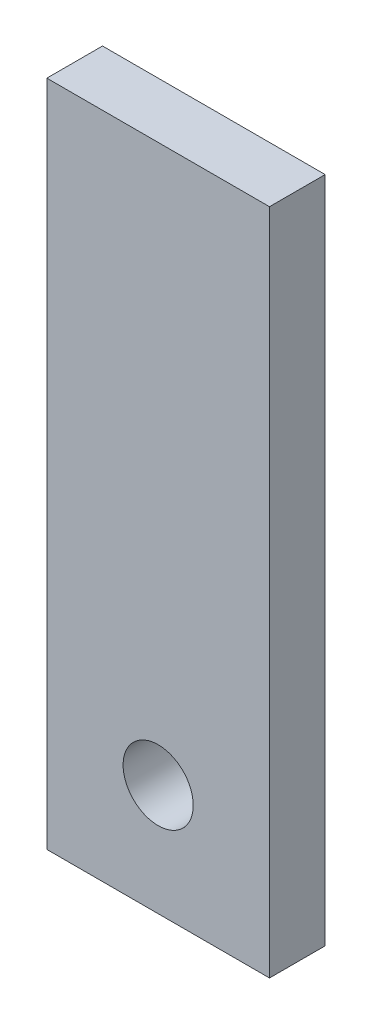
from build123d import *

# Parameters (mm, degrees)
SKETCH1_W           = 25.4
SKETCH1_H           = 76.2
BOSS_EXTRUDE1_DEPTH = 6.35
SKETCH2_R           = 4
CUT_EXTRUDE1_DEPTH  = 41.659838908


with BuildPart() as part:
    # Sketch1 → Boss-Extrude1 (new body)
    with BuildSketch(Plane.XY):
        Rectangle(SKETCH1_W, SKETCH1_H)
    extrude(amount=BOSS_EXTRUDE1_DEPTH)

    # Sketch2 → Cut-Extrude1 (cut, through all)
    with BuildSketch(Plane.XY.offset(6.35)):
        with Locations((0, -25.4)):
            Circle(SKETCH2_R)
    extrude(amount=-CUT_EXTRUDE1_DEPTH, mode=Mode.SUBTRACT)


solid = part.part
